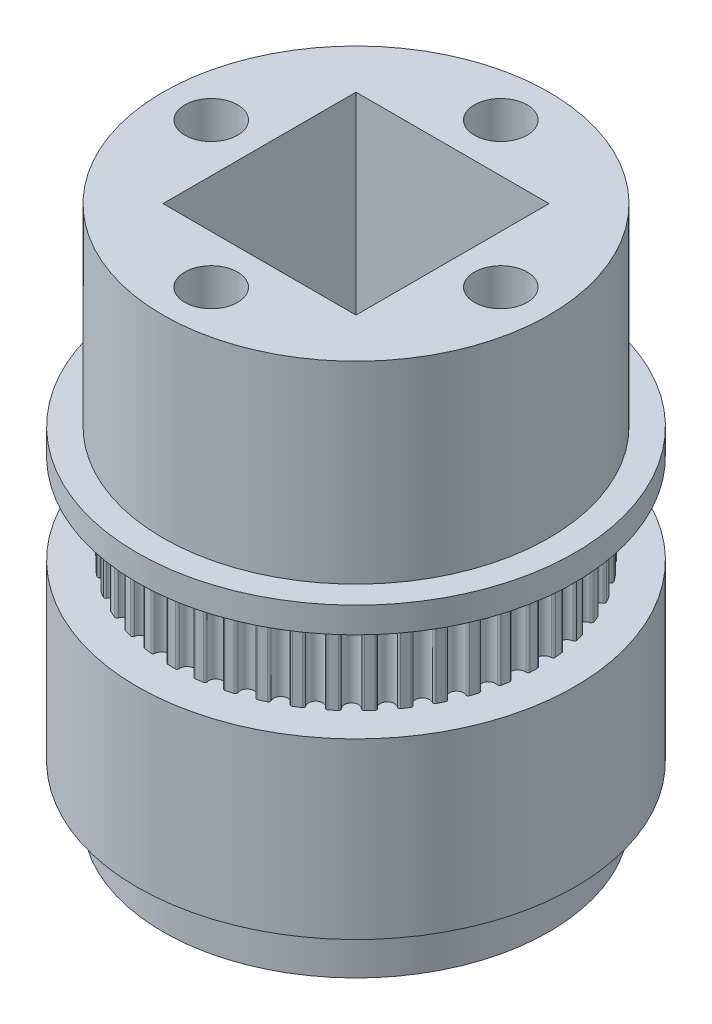
from build123d import *

# Parameters (mm, degrees)
CUT_EXTRUDE1_START       = -4
CUT_EXTRUDE1_DEPTH       = 13
CUT_EXTRUDE1_2_OUTLINE_R = 17
CUT_EXTRUDE1_2_DEPTH     = 4
CUT_EXTRUDE1_START_2     = 7
CUT_EXTRUDE1_3_OUTLINE_R = 17
CUT_EXTRUDE1_3_DEPTH     = 2
SKETCH2_R                = 17
CUT_EXTRUDE2_DEPTH       = 2
BOSS_EXTRUDE1_START      = 11.5
SKETCH3_R                = 17
BOSS_EXTRUDE1_DEPTH      = 11.5
SKETCH4_R                = 15
BOSS_EXTRUDE2_DEPTH      = 4
BOSS_EXTRUDE3_START      = 15
SKETCH5_R                = 15
BOSS_EXTRUDE3_DEPTH      = 15
SKETCH6_W                = 15
SKETCH6_H                = 15
CUT_EXTRUDE3_DEPTH       = 25
SKETCH7_R                = 2.05
CUT_EXTRUDE4_DEPTH       = 7


with BuildPart() as part:
    # Cut-Extrude1: read off the stored shape, not the designer's step
    # Cut-Extrude1 outline → Cut-Extrude1 (new body)
    with BuildSketch(Plane(origin=(0, 4, 0), x_dir=(1, 0, 0), z_dir=(0, 1, 0)).offset(CUT_EXTRUDE1_START)):
        with BuildLine():
            ThreePointArc((-2.696211539, 14.067901059), (-2.978115599, 14.010932316), (-3.258819048, 13.948315142))
            ThreePointArc((-3.258819048, 13.948315142), (-3.355231436, 13.876138224), (-3.367490736, 13.756327684))
            ThreePointArc((-3.367490736, 13.756327684), (-3.742864461, 13.052919583), (-4.433948937, 13.450525716))
            ThreePointArc((-4.433948937, 13.450525716), (-4.507835327, 13.545634377), (-4.627845608, 13.555753093))
            ThreePointArc((-4.627845608, 13.555753093), (-4.89907768, 13.460105303), (-5.168334716, 13.359031145))
            ThreePointArc((-5.168334716, 13.359031145), (-5.253763741, 13.274138638), (-5.249229329, 13.15378792))
            ThreePointArc((-5.249229329, 13.15378792), (-5.523054456, 12.404983413), (-6.262749424, 12.702539701))
            ThreePointArc((-6.262749424, 12.702539701), (-6.349153323, 12.786439774), (-6.469403926, 12.779757811))
            ThreePointArc((-6.469403926, 12.779757811), (-6.724684788, 12.647292651), (-6.977254629, 12.509728803))
            ThreePointArc((-6.977254629, 12.509728803), (-7.05003751, 12.413773041), (-7.028797645, 12.295224637))
            ThreePointArc((-7.028797645, 12.295224637), (-7.195744479, 11.515598352), (-7.969652618, 11.7073132))
            ThreePointArc((-7.969652618, 11.7073132), (-8.066892274, 11.778371664), (-8.185042656, 11.755019081))
            ThreePointArc((-8.185042656, 11.755019081), (-8.419403554, 11.588314833), (-8.650370216, 11.416938819))
            ThreePointArc((-8.650370216, 11.416938819), (-8.709090318, 11.311787473), (-8.671558409, 11.197348792))
            ThreePointArc((-8.671558409, 11.197348792), (-8.72837752, 10.402075267), (-9.521435588, 10.484217164))
            ThreePointArc((-9.521435588, 10.484217164), (-9.627618341, 10.541050948), (-9.741368841, 10.501482275))
            ThreePointArc((-9.741368841, 10.501482275), (-9.950248208, 10.303783649), (-10.155116186, 10.101931108))
            ThreePointArc((-10.155116186, 10.101931108), (-10.19863059, 9.989630829), (-10.145537152, 9.881529289))
            ThreePointArc((-10.145537152, 9.881529289), (-10.091122622, 9.08608762), (-10.887894645, 9.057057767))
            ThreePointArc((-10.887894645, 9.057057767), (-11.000953769, 9.098560665), (-11.108090362, 9.043546063))
            ThreePointArc((-11.108090362, 9.043546063), (-11.287422598, 8.818701036), (-11.462204372, 8.590300799))
            ThreePointArc((-11.462204372, 8.590300799), (-11.489666118, 8.473037384), (-11.422044556, 8.373377059))
            ThreePointArc((-11.422044556, 8.373377059), (-11.2574555, 7.593249613), (-12.042433218, 7.453613043))
            ThreePointArc((-12.042433218, 7.453613043), (-12.160168145, 7.478977249), (-12.258605539, 7.409587513))
            ThreePointArc((-12.258605539, 7.409587513), (-12.404900147, 7.161972439), (-12.546193787, 6.911470056))
            ThreePointArc((-12.546193787, 6.911470056), (-12.557068364, 6.791525904), (-12.476234854, 6.702246569))
            ThreePointArc((-12.476234854, 6.702246569), (-12.204674812, 5.952617639), (-12.962579526, 5.705092219))
            ThreePointArc((-12.962579526, 5.705092219), (-13.08269868, 5.713824047), (-13.170520904, 5.63140977))
            ThreePointArc((-13.170520904, 5.63140977), (-13.280930425, 5.365844195), (-13.385985812, 5.09811541))
            ThreePointArc((-13.385985812, 5.09811541), (-13.380061559, 4.977825097), (-13.287589432, 4.900664473))
            ThreePointArc((-13.287589432, 4.900664473), (-12.914344011, 4.196124733), (-13.630423969, 3.845528264))
            ThreePointArc((-13.630423969, 3.845528264), (-13.750589367, 3.83745776), (-13.82608706, 3.743623042))
            ThreePointArc((-13.82608706, 3.743623042), (-13.898462499, 3.465275898), (-13.965234848, 3.185531746))
            ThreePointArc((-13.965234848, 3.185531746), (-13.942627074, 3.067236587), (-13.840316197, 3.003696518))
            ThreePointArc((-13.840316197, 3.003696518), (-13.372650194, 2.357959033), (-14.032967713, 1.911115477))
            ThreePointArc((-14.032967713, 1.911115477), (-14.150840473, 1.886399723), (-14.212544159, 1.782970949))
            ThreePointArc((-14.212544159, 1.782970949), (-14.245476809, 1.497259946), (-14.272666474, 1.210945331))
            ThreePointArc((-14.272666474, 1.210945331), (-14.233815213, 1.096947806), (-14.12365695, 1.048265026))
            ThreePointArc((-14.12365695, 1.048265026), (-13.570672952, 0.473898342), (-14.162375703, -0.060495))
            ThreePointArc((-14.162375703, -0.060495), (-14.275661565, -0.101374939), (-14.322370252, -0.212384644))
            ThreePointArc((-14.322370252, -0.212384644), (-14.315219118, -0.499898467), (-14.302296882, -0.787210758))
            ThreePointArc((-14.302296882, -0.787210758), (-14.24795833, -0.894691816), (-14.132096786, -0.927569751))
            ThreePointArc((-14.132096786, -0.927569751), (-13.504557997, -1.419386241), (-14.01612916, -2.030928011))
            ThreePointArc((-14.01612916, -2.030928011), (-14.122623144, -2.087176454), (-14.1534277, -2.203606413))
            ThreePointArc((-14.1534277, -2.203606413), (-14.10633197, -2.487326925), (-14.053549349, -2.770044685))
            ThreePointArc((-14.053549349, -2.770044685), (-13.984781144, -2.86891728), (-13.865471432, -2.885350439))
            ThreePointArc((-13.865471432, -2.885350439), (-13.175592183, -3.285044085), (-13.597074605, -3.961831317))
            ThreePointArc((-13.597074605, -3.961831317), (-13.694703927, -4.032353453), (-13.709004777, -4.151937489))
            ThreePointArc((-13.709004777, -4.151937489), (-13.622881116, -4.426342394), (-13.531265465, -4.698962843))
            ThreePointArc((-13.531265465, -4.698962843), (-13.449406101, -4.787302532), (-13.32897045, -4.786971063))
            ThreePointArc((-13.32897045, -4.786971063), (-12.590178453, -5.086762283), (-12.91336846, -5.815622084))
            ThreePointArc((-12.91336846, -5.815622084), (-13.000232875, -5.899045278), (-12.997751669, -6.019455824))
            ThreePointArc((-12.997751669, -6.019455824), (-12.874276376, -6.279204142), (-12.745610889, -6.536421034))
            ThreePointArc((-12.745610889, -6.536421034), (-12.652253667, -6.612508386), (-12.533036219, -6.595418739))
            ThreePointArc((-12.533036219, -6.595418739), (-11.759711221, -6.789472439), (-11.978318286, -7.556218382))
            ThreePointArc((-11.978318286, -7.556218382), (-12.052727079, -7.650918897), (-12.03351211, -7.769812299))
            ThreePointArc((-12.03351211, -7.769812299), (-11.875088491, -8.009848325), (-11.711877496, -8.246655225))
            ThreePointArc((-11.711877496, -8.246655225), (-11.608839507, -8.309009286), (-11.493160693, -8.275494093))
            ThreePointArc((-11.493160693, -8.275494093), (-10.700354587, -8.360033237), (-10.810123772, -9.149741484))
            ThreePointArc((-10.810123772, -9.149741484), (-10.870628659, -9.253876083), (-10.835053926, -9.368938216))
            ThreePointArc((-10.835053926, -9.368938216), (-10.644765517, -9.584589922), (-10.450185729, -9.796377653))
            ThreePointArc((-10.450185729, -9.796377653), (-10.339472491, -9.843784772), (-10.229583869, -9.794496366))
            ThreePointArc((-10.229583869, -9.794496366), (-9.432727722, -9.767875498), (-9.431522495, -10.565175276))
            ThreePointArc((-9.431522495, -10.565175276), (-9.476945818, -10.676717097), (-9.425703742, -10.785708407))
            ThreePointArc((-9.425703742, -10.785708407), (-9.20725429, -10.972778378), (-8.985092983, -11.155424732))
            ThreePointArc((-8.985092983, -11.155424732), (-8.868859403, -11.186962184), (-8.76689983, -11.12285991))
            ThreePointArc((-8.76689983, -11.12285991), (-7.981503541, -10.985597172), (-7.869347361, -11.774969949))
            ThreePointArc((-7.869347361, -11.774969949), (-7.898805006, -11.891747957), (-7.832892956, -11.992547053))
            ThreePointArc((-7.832892956, -11.992547053), (-7.590534331, -12.147394183), (-7.345115624, -12.297344158))
            ThreePointArc((-7.345115624, -12.297344158), (-7.225624056, -12.312398102), (-7.133578059, -12.234729637))
            ThreePointArc((-7.133578059, -12.234729637), (-6.374928473, -11.989496694), (-6.154004332, -12.755578226))
            ThreePointArc((-6.154004332, -12.755578226), (-6.16692294, -12.875319471), (-6.087623818, -12.965964412))
            ThreePointArc((-6.087623818, -12.965964412), (-5.826073255, -13.085574779), (-5.562173943, -13.199909769))
            ThreePointArc((-5.562173943, -13.199909769), (-5.441750155, -13.198187196), (-5.361409304, -13.108464268))
            ThreePointArc((-5.361409304, -13.108464268), (-4.644272673, -12.7600343), (-4.318880609, -13.487913682))
            ThreePointArc((-4.318880609, -13.487913682), (-4.315008733, -13.608287535), (-4.223866008, -13.687014022))
            ThreePointArc((-4.223866008, -13.687014022), (-3.948214291, -13.769059546), (-3.670970874, -13.84555415))
            ThreePointArc((-3.670970874, -13.84555415), (-3.551958777, -13.827088589), (-3.484886816, -13.727057554))
            ThreePointArc((-3.484886816, -13.727057554), (-2.823221389, -13.282212353), (-2.399694787, -13.95772224))
            ThreePointArc((-2.399694787, -13.95772224), (-2.37910779, -14.076385763), (-2.27789545, -14.141661472))
            ThreePointArc((-2.27789545, -14.141661472), (-1.993507827, -14.184545231), (-1.708316532, -14.221710569))
            ThreePointArc((-1.708316532, -14.221710569), (-1.593032562, -14.186861431), (-1.540534971, -14.078469278))
            ThreePointArc((-1.540534971, -14.078469278), (-0.947219312, -13.545867251), (-0.433801636, -14.155859612))
            ThreePointArc((-0.433801636, -14.155859612), (-0.396900219, -14.270503153), (-0.287588248, -14.321057568))
            ThreePointArc((-0.287588248, -14.321057568), (0, -14.323944878), (0.287588248, -14.321057568))
            ThreePointArc((0.287588248, -14.321057568), (0.396900219, -14.270503153), (0.433801636, -14.155859612))
            ThreePointArc((0.433801636, -14.155859612), (0.947219312, -13.545867251), (1.540534971, -14.078469278))
            ThreePointArc((1.540534971, -14.078469278), (1.593032562, -14.186861431), (1.708316532, -14.221710569))
            ThreePointArc((1.708316532, -14.221710569), (1.993507827, -14.184545231), (2.27789545, -14.141661472))
            ThreePointArc((2.27789545, -14.141661472), (2.37910779, -14.076385763), (2.399694787, -13.95772224))
            ThreePointArc((2.399694787, -13.95772224), (2.823221389, -13.282212353), (3.484886816, -13.727057554))
            ThreePointArc((3.484886816, -13.727057554), (3.551958777, -13.827088589), (3.670970874, -13.84555415))
            ThreePointArc((3.670970874, -13.84555415), (3.948214291, -13.769059546), (4.223866008, -13.687014022))
            ThreePointArc((4.223866008, -13.687014022), (4.315008733, -13.608287535), (4.318880609, -13.487913682))
            ThreePointArc((4.318880609, -13.487913682), (4.644272673, -12.7600343), (5.361409304, -13.108464268))
            ThreePointArc((5.361409304, -13.108464268), (5.441750155, -13.198187196), (5.562173943, -13.199909769))
            ThreePointArc((5.562173943, -13.199909769), (5.826073255, -13.085574779), (6.087623818, -12.965964412))
            ThreePointArc((6.087623818, -12.965964412), (6.16692294, -12.875319471), (6.154004332, -12.755578226))
            ThreePointArc((6.154004332, -12.755578226), (6.374928473, -11.989496694), (7.133578059, -12.234729637))
            ThreePointArc((7.133578059, -12.234729637), (7.225624056, -12.312398102), (7.345115624, -12.297344158))
            ThreePointArc((7.345115624, -12.297344158), (7.590534331, -12.147394183), (7.832892956, -11.992547053))
            ThreePointArc((7.832892956, -11.992547053), (7.898805006, -11.891747957), (7.869347361, -11.774969949))
            ThreePointArc((7.869347361, -11.774969949), (7.981503541, -10.985597172), (8.76689983, -11.12285991))
            ThreePointArc((8.76689983, -11.12285991), (8.868859403, -11.186962184), (8.985092983, -11.155424732))
            ThreePointArc((8.985092983, -11.155424732), (9.20725429, -10.972778378), (9.425703742, -10.785708407))
            ThreePointArc((9.425703742, -10.785708407), (9.476945818, -10.676717097), (9.431522495, -10.565175276))
            ThreePointArc((9.431522495, -10.565175276), (9.432727722, -9.767875498), (10.229583869, -9.794496366))
            ThreePointArc((10.229583869, -9.794496366), (10.339472491, -9.843784772), (10.450185729, -9.796377653))
            ThreePointArc((10.450185729, -9.796377653), (10.644765517, -9.584589922), (10.835053926, -9.368938216))
            ThreePointArc((10.835053926, -9.368938216), (10.870628659, -9.253876083), (10.810123772, -9.149741484))
            ThreePointArc((10.810123772, -9.149741484), (10.700354587, -8.360033237), (11.493160693, -8.275494093))
            ThreePointArc((11.493160693, -8.275494093), (11.608839507, -8.309009286), (11.711877496, -8.246655225))
            ThreePointArc((11.711877496, -8.246655225), (11.875088491, -8.009848325), (12.03351211, -7.769812299))
            ThreePointArc((12.03351211, -7.769812299), (12.052727079, -7.650918897), (11.978318286, -7.556218382))
            ThreePointArc((11.978318286, -7.556218382), (11.759711221, -6.789472439), (12.533036219, -6.595418739))
            ThreePointArc((12.533036219, -6.595418739), (12.652253667, -6.612508386), (12.745610889, -6.536421034))
            ThreePointArc((12.745610889, -6.536421034), (12.874276376, -6.279204142), (12.997751669, -6.019455824))
            ThreePointArc((12.997751669, -6.019455824), (13.000232875, -5.899045278), (12.91336846, -5.815622084))
            ThreePointArc((12.91336846, -5.815622084), (12.590178453, -5.086762283), (13.32897045, -4.786971063))
            ThreePointArc((13.32897045, -4.786971063), (13.449406101, -4.787302532), (13.531265465, -4.698962843))
            ThreePointArc((13.531265465, -4.698962843), (13.622881116, -4.426342394), (13.709004777, -4.151937489))
            ThreePointArc((13.709004777, -4.151937489), (13.694703927, -4.032353453), (13.597074605, -3.961831317))
            ThreePointArc((13.597074605, -3.961831317), (13.175592183, -3.285044085), (13.865471432, -2.885350439))
            ThreePointArc((13.865471432, -2.885350439), (13.984781144, -2.86891728), (14.053549349, -2.770044685))
            ThreePointArc((14.053549349, -2.770044685), (14.10633197, -2.487326925), (14.1534277, -2.203606413))
            ThreePointArc((14.1534277, -2.203606413), (14.122623144, -2.087176454), (14.01612916, -2.030928011))
            ThreePointArc((14.01612916, -2.030928011), (13.504557997, -1.419386241), (14.132096786, -0.927569751))
            ThreePointArc((14.132096786, -0.927569751), (14.24795833, -0.894691816), (14.302296882, -0.787210758))
            ThreePointArc((14.302296882, -0.787210758), (14.315219118, -0.499898467), (14.322370252, -0.212384644))
            ThreePointArc((14.322370252, -0.212384644), (14.275661565, -0.101374939), (14.162375703, -0.060495))
            ThreePointArc((14.162375703, -0.060495), (13.570672952, 0.473898342), (14.12365695, 1.048265026))
            ThreePointArc((14.12365695, 1.048265026), (14.233815213, 1.096947806), (14.272666474, 1.210945331))
            ThreePointArc((14.272666474, 1.210945331), (14.245476809, 1.497259946), (14.212544159, 1.782970949))
            ThreePointArc((14.212544159, 1.782970949), (14.150840473, 1.886399723), (14.032967713, 1.911115477))
            ThreePointArc((14.032967713, 1.911115477), (13.372650194, 2.357959033), (13.840316197, 3.003696518))
            ThreePointArc((13.840316197, 3.003696518), (13.942627074, 3.067236587), (13.965234848, 3.185531746))
            ThreePointArc((13.965234848, 3.185531746), (13.898462499, 3.465275898), (13.82608706, 3.743623042))
            ThreePointArc((13.82608706, 3.743623042), (13.750589367, 3.83745776), (13.630423969, 3.845528264))
            ThreePointArc((13.630423969, 3.845528264), (12.914344011, 4.196124733), (13.287589432, 4.900664473))
            ThreePointArc((13.287589432, 4.900664473), (13.380061559, 4.977825097), (13.385985812, 5.09811541))
            ThreePointArc((13.385985812, 5.09811541), (13.280930425, 5.365844195), (13.170520904, 5.63140977))
            ThreePointArc((13.170520904, 5.63140977), (13.08269868, 5.713824047), (12.962579526, 5.705092219))
            ThreePointArc((12.962579526, 5.705092219), (12.204674812, 5.952617639), (12.476234854, 6.702246569))
            ThreePointArc((12.476234854, 6.702246569), (12.557068364, 6.791525904), (12.546193787, 6.911470056))
            ThreePointArc((12.546193787, 6.911470056), (12.404900147, 7.161972439), (12.258605539, 7.409587513))
            ThreePointArc((12.258605539, 7.409587513), (12.160168145, 7.478977249), (12.042433218, 7.453613043))
            ThreePointArc((12.042433218, 7.453613043), (11.2574555, 7.593249613), (11.422044556, 8.373377059))
            ThreePointArc((11.422044556, 8.373377059), (11.489666118, 8.473037384), (11.462204372, 8.590300799))
            ThreePointArc((11.462204372, 8.590300799), (11.287422598, 8.818701036), (11.108090362, 9.043546063))
            ThreePointArc((11.108090362, 9.043546063), (11.000953769, 9.098560665), (10.887894645, 9.057057767))
            ThreePointArc((10.887894645, 9.057057767), (10.091122622, 9.08608762), (10.145537152, 9.881529289))
            ThreePointArc((10.145537152, 9.881529289), (10.19863059, 9.989630829), (10.155116186, 10.101931108))
            ThreePointArc((10.155116186, 10.101931108), (9.950248208, 10.303783649), (9.741368841, 10.501482275))
            ThreePointArc((9.741368841, 10.501482275), (9.627618341, 10.541050948), (9.521435588, 10.484217164))
            ThreePointArc((9.521435588, 10.484217164), (8.72837752, 10.402075267), (8.671558409, 11.197348792))
            ThreePointArc((8.671558409, 11.197348792), (8.709090318, 11.311787473), (8.650370216, 11.416938819))
            ThreePointArc((8.650370216, 11.416938819), (8.419403554, 11.588314833), (8.185042656, 11.755019081))
            ThreePointArc((8.185042656, 11.755019081), (8.066892274, 11.778371664), (7.969652618, 11.7073132))
            ThreePointArc((7.969652618, 11.7073132), (7.195744479, 11.515598352), (7.028797645, 12.295224637))
            ThreePointArc((7.028797645, 12.295224637), (7.05003751, 12.413773041), (6.977254629, 12.509728803))
            ThreePointArc((6.977254629, 12.509728803), (6.724684788, 12.647292651), (6.469403926, 12.779757811))
            ThreePointArc((6.469403926, 12.779757811), (6.349153323, 12.786439774), (6.262749424, 12.702539701))
            ThreePointArc((6.262749424, 12.702539701), (5.523054456, 12.404983413), (5.249229329, 13.15378792))
            ThreePointArc((5.249229329, 13.15378792), (5.253763741, 13.274138638), (5.168334716, 13.359031145))
            ThreePointArc((5.168334716, 13.359031145), (4.89907768, 13.460105303), (4.627845608, 13.555753093))
            ThreePointArc((4.627845608, 13.555753093), (4.507835327, 13.545634377), (4.433948937, 13.450525716))
            ThreePointArc((4.433948937, 13.450525716), (3.742864461, 13.052919583), (3.367490736, 13.756327684))
            ThreePointArc((3.367490736, 13.756327684), (3.355231436, 13.876138224), (3.258819048, 13.948315142))
            ThreePointArc((3.258819048, 13.948315142), (2.978115599, 14.010932316), (2.696211539, 14.067901059))
            ThreePointArc((2.696211539, 14.067901059), (2.578777442, 14.041178616), (2.518846677, 13.936712547))
            ThreePointArc((2.518846677, 13.936712547), (1.889823866, 13.44679552), (1.420207766, 14.091116177))
            ThreePointArc((1.420207766, 14.091116177), (1.391393369, 14.208054564), (1.285874174, 14.26611105))
            ThreePointArc((1.285874174, 14.26611105), (0.999187885, 14.289052468), (0.712098779, 14.306233334))
            ThreePointArc((0.712098779, 14.306233334), (0.599526588, 14.263427284), (0.554717932, 14.151637121))
            ThreePointArc((0.554717932, 14.151637121), (0, 13.578944878), (-0.554717932, 14.151637121))
            ThreePointArc((-0.554717932, 14.151637121), (-0.599526588, 14.263427284), (-0.712098779, 14.306233334))
            ThreePointArc((-0.712098779, 14.306233334), (-0.999187885, 14.289052468), (-1.285874174, 14.26611105))
            ThreePointArc((-1.285874174, 14.26611105), (-1.391393369, 14.208054564), (-1.420207766, 14.091116177))
            ThreePointArc((-1.420207766, 14.091116177), (-1.889823866, 13.44679552), (-2.518846677, 13.936712547))
            ThreePointArc((-2.518846677, 13.936712547), (-2.578777442, 14.041178616), (-2.696211539, 14.067901059))
        make_face()
    extrude(amount=CUT_EXTRUDE1_DEPTH)

    # Cut-Extrude1 2 outline → Cut-Extrude1 2 (add)
    with BuildSketch(Plane(origin=(0, 4, 0), x_dir=(1, 0, 0), z_dir=(0, 1, 0)).offset(CUT_EXTRUDE1_START)):
        Circle(CUT_EXTRUDE1_2_OUTLINE_R)
        with BuildLine():
            ThreePointArc((-3.367490736, 13.756327684), (-3.355231436, 13.876138224), (-3.258819048, 13.948315142))
            ThreePointArc((-3.258819048, 13.948315142), (-2.978115599, 14.010932316), (-2.696211539, 14.067901059))
            ThreePointArc((-2.696211539, 14.067901059), (-2.578777442, 14.041178616), (-2.518846677, 13.936712547))
            ThreePointArc((-2.518846677, 13.936712547), (-1.889823866, 13.44679552), (-1.420207766, 14.091116177))
            ThreePointArc((-1.420207766, 14.091116177), (-1.391393369, 14.208054564), (-1.285874174, 14.26611105))
            ThreePointArc((-1.285874174, 14.26611105), (-0.999187885, 14.289052468), (-0.712098779, 14.306233334))
            ThreePointArc((-0.712098779, 14.306233334), (-0.599526588, 14.263427284), (-0.554717932, 14.151637121))
            ThreePointArc((-0.554717932, 14.151637121), (0, 13.578944878), (0.554717932, 14.151637121))
            ThreePointArc((0.554717932, 14.151637121), (0.599526588, 14.263427284), (0.712098779, 14.306233334))
            ThreePointArc((0.712098779, 14.306233334), (0.999187885, 14.289052468), (1.285874174, 14.26611105))
            ThreePointArc((1.285874174, 14.26611105), (1.391393369, 14.208054564), (1.420207766, 14.091116177))
            ThreePointArc((1.420207766, 14.091116177), (1.889823866, 13.44679552), (2.518846677, 13.936712547))
            ThreePointArc((2.518846677, 13.936712547), (2.578777442, 14.041178616), (2.696211539, 14.067901059))
            ThreePointArc((2.696211539, 14.067901059), (2.978115599, 14.010932316), (3.258819048, 13.948315142))
            ThreePointArc((3.258819048, 13.948315142), (3.355231436, 13.876138224), (3.367490736, 13.756327684))
            ThreePointArc((3.367490736, 13.756327684), (3.742864461, 13.052919583), (4.433948937, 13.450525716))
            ThreePointArc((4.433948937, 13.450525716), (4.507835327, 13.545634377), (4.627845608, 13.555753093))
            ThreePointArc((4.627845608, 13.555753093), (4.89907768, 13.460105303), (5.168334716, 13.359031145))
            ThreePointArc((5.168334716, 13.359031145), (5.253763741, 13.274138638), (5.249229329, 13.15378792))
            ThreePointArc((5.249229329, 13.15378792), (5.523054456, 12.404983413), (6.262749424, 12.702539701))
            ThreePointArc((6.262749424, 12.702539701), (6.349153323, 12.786439774), (6.469403926, 12.779757811))
            ThreePointArc((6.469403926, 12.779757811), (6.724684788, 12.647292651), (6.977254629, 12.509728803))
            ThreePointArc((6.977254629, 12.509728803), (7.05003751, 12.413773041), (7.028797645, 12.295224637))
            ThreePointArc((7.028797645, 12.295224637), (7.195744479, 11.515598352), (7.969652618, 11.7073132))
            ThreePointArc((7.969652618, 11.7073132), (8.066892274, 11.778371664), (8.185042656, 11.755019081))
            ThreePointArc((8.185042656, 11.755019081), (8.419403554, 11.588314833), (8.650370216, 11.416938819))
            ThreePointArc((8.650370216, 11.416938819), (8.709090318, 11.311787473), (8.671558409, 11.197348792))
            ThreePointArc((8.671558409, 11.197348792), (8.72837752, 10.402075267), (9.521435588, 10.484217164))
            ThreePointArc((9.521435588, 10.484217164), (9.627618341, 10.541050948), (9.741368841, 10.501482275))
            ThreePointArc((9.741368841, 10.501482275), (9.950248208, 10.303783649), (10.155116186, 10.101931108))
            ThreePointArc((10.155116186, 10.101931108), (10.19863059, 9.989630829), (10.145537152, 9.881529289))
            ThreePointArc((10.145537152, 9.881529289), (10.091122622, 9.08608762), (10.887894645, 9.057057767))
            ThreePointArc((10.887894645, 9.057057767), (11.000953769, 9.098560665), (11.108090362, 9.043546063))
            ThreePointArc((11.108090362, 9.043546063), (11.287422598, 8.818701036), (11.462204372, 8.590300799))
            ThreePointArc((11.462204372, 8.590300799), (11.489666118, 8.473037384), (11.422044556, 8.373377059))
            ThreePointArc((11.422044556, 8.373377059), (11.2574555, 7.593249613), (12.042433218, 7.453613043))
            ThreePointArc((12.042433218, 7.453613043), (12.160168145, 7.478977249), (12.258605539, 7.409587513))
            ThreePointArc((12.258605539, 7.409587513), (12.404900147, 7.161972439), (12.546193787, 6.911470056))
            ThreePointArc((12.546193787, 6.911470056), (12.557068364, 6.791525904), (12.476234854, 6.702246569))
            ThreePointArc((12.476234854, 6.702246569), (12.204674812, 5.952617639), (12.962579526, 5.705092219))
            ThreePointArc((12.962579526, 5.705092219), (13.08269868, 5.713824047), (13.170520904, 5.63140977))
            ThreePointArc((13.170520904, 5.63140977), (13.280930425, 5.365844195), (13.385985812, 5.09811541))
            ThreePointArc((13.385985812, 5.09811541), (13.380061559, 4.977825097), (13.287589432, 4.900664473))
            ThreePointArc((13.287589432, 4.900664473), (12.914344011, 4.196124733), (13.630423969, 3.845528264))
            ThreePointArc((13.630423969, 3.845528264), (13.750589367, 3.83745776), (13.82608706, 3.743623042))
            ThreePointArc((13.82608706, 3.743623042), (13.898462499, 3.465275898), (13.965234848, 3.185531746))
            ThreePointArc((13.965234848, 3.185531746), (13.942627074, 3.067236587), (13.840316197, 3.003696518))
            ThreePointArc((13.840316197, 3.003696518), (13.372650194, 2.357959033), (14.032967713, 1.911115477))
            ThreePointArc((14.032967713, 1.911115477), (14.150840473, 1.886399723), (14.212544159, 1.782970949))
            ThreePointArc((14.212544159, 1.782970949), (14.245476809, 1.497259946), (14.272666474, 1.210945331))
            ThreePointArc((14.272666474, 1.210945331), (14.233815213, 1.096947806), (14.12365695, 1.048265026))
            ThreePointArc((14.12365695, 1.048265026), (13.570672952, 0.473898342), (14.162375703, -0.060495))
            ThreePointArc((14.162375703, -0.060495), (14.275661565, -0.101374939), (14.322370252, -0.212384644))
            ThreePointArc((14.322370252, -0.212384644), (14.315219118, -0.499898467), (14.302296882, -0.787210758))
            ThreePointArc((14.302296882, -0.787210758), (14.24795833, -0.894691816), (14.132096786, -0.927569751))
            ThreePointArc((14.132096786, -0.927569751), (13.504557997, -1.419386241), (14.01612916, -2.030928011))
            ThreePointArc((14.01612916, -2.030928011), (14.122623144, -2.087176454), (14.1534277, -2.203606413))
            ThreePointArc((14.1534277, -2.203606413), (14.10633197, -2.487326925), (14.053549349, -2.770044685))
            ThreePointArc((14.053549349, -2.770044685), (13.984781144, -2.86891728), (13.865471432, -2.885350439))
            ThreePointArc((13.865471432, -2.885350439), (13.175592183, -3.285044085), (13.597074605, -3.961831317))
            ThreePointArc((13.597074605, -3.961831317), (13.694703927, -4.032353453), (13.709004777, -4.151937489))
            ThreePointArc((13.709004777, -4.151937489), (13.622881116, -4.426342394), (13.531265465, -4.698962843))
            ThreePointArc((13.531265465, -4.698962843), (13.449406101, -4.787302532), (13.32897045, -4.786971063))
            ThreePointArc((13.32897045, -4.786971063), (12.590178453, -5.086762283), (12.91336846, -5.815622084))
            ThreePointArc((12.91336846, -5.815622084), (13.000232875, -5.899045278), (12.997751669, -6.019455824))
            ThreePointArc((12.997751669, -6.019455824), (12.874276376, -6.279204142), (12.745610889, -6.536421034))
            ThreePointArc((12.745610889, -6.536421034), (12.652253667, -6.612508386), (12.533036219, -6.595418739))
            ThreePointArc((12.533036219, -6.595418739), (11.759711221, -6.789472439), (11.978318286, -7.556218382))
            ThreePointArc((11.978318286, -7.556218382), (12.052727079, -7.650918897), (12.03351211, -7.769812299))
            ThreePointArc((12.03351211, -7.769812299), (11.875088491, -8.009848325), (11.711877496, -8.246655225))
            ThreePointArc((11.711877496, -8.246655225), (11.608839507, -8.309009286), (11.493160693, -8.275494093))
            ThreePointArc((11.493160693, -8.275494093), (10.700354587, -8.360033237), (10.810123772, -9.149741484))
            ThreePointArc((10.810123772, -9.149741484), (10.870628659, -9.253876083), (10.835053926, -9.368938216))
            ThreePointArc((10.835053926, -9.368938216), (10.644765517, -9.584589922), (10.450185729, -9.796377653))
            ThreePointArc((10.450185729, -9.796377653), (10.339472491, -9.843784772), (10.229583869, -9.794496366))
            ThreePointArc((10.229583869, -9.794496366), (9.432727722, -9.767875498), (9.431522495, -10.565175276))
            ThreePointArc((9.431522495, -10.565175276), (9.476945818, -10.676717097), (9.425703742, -10.785708407))
            ThreePointArc((9.425703742, -10.785708407), (9.20725429, -10.972778378), (8.985092983, -11.155424732))
            ThreePointArc((8.985092983, -11.155424732), (8.868859403, -11.186962184), (8.76689983, -11.12285991))
            ThreePointArc((8.76689983, -11.12285991), (7.981503541, -10.985597172), (7.869347361, -11.774969949))
            ThreePointArc((7.869347361, -11.774969949), (7.898805006, -11.891747957), (7.832892956, -11.992547053))
            ThreePointArc((7.832892956, -11.992547053), (7.590534331, -12.147394183), (7.345115624, -12.297344158))
            ThreePointArc((7.345115624, -12.297344158), (7.225624056, -12.312398102), (7.133578059, -12.234729637))
            ThreePointArc((7.133578059, -12.234729637), (6.374928473, -11.989496694), (6.154004332, -12.755578226))
            ThreePointArc((6.154004332, -12.755578226), (6.16692294, -12.875319471), (6.087623818, -12.965964412))
            ThreePointArc((6.087623818, -12.965964412), (5.826073255, -13.085574779), (5.562173943, -13.199909769))
            ThreePointArc((5.562173943, -13.199909769), (5.441750155, -13.198187196), (5.361409304, -13.108464268))
            ThreePointArc((5.361409304, -13.108464268), (4.644272673, -12.7600343), (4.318880609, -13.487913682))
            ThreePointArc((4.318880609, -13.487913682), (4.315008733, -13.608287535), (4.223866008, -13.687014022))
            ThreePointArc((4.223866008, -13.687014022), (3.948214291, -13.769059546), (3.670970874, -13.84555415))
            ThreePointArc((3.670970874, -13.84555415), (3.551958777, -13.827088589), (3.484886816, -13.727057554))
            ThreePointArc((3.484886816, -13.727057554), (2.823221389, -13.282212353), (2.399694787, -13.95772224))
            ThreePointArc((2.399694787, -13.95772224), (2.37910779, -14.076385763), (2.27789545, -14.141661472))
            ThreePointArc((2.27789545, -14.141661472), (1.993507827, -14.184545231), (1.708316532, -14.221710569))
            ThreePointArc((1.708316532, -14.221710569), (1.593032562, -14.186861431), (1.540534971, -14.078469278))
            ThreePointArc((1.540534971, -14.078469278), (0.947219312, -13.545867251), (0.433801636, -14.155859612))
            ThreePointArc((0.433801636, -14.155859612), (0.396900219, -14.270503153), (0.287588248, -14.321057568))
            ThreePointArc((0.287588248, -14.321057568), (0, -14.323944878), (-0.287588248, -14.321057568))
            ThreePointArc((-0.287588248, -14.321057568), (-0.396900219, -14.270503153), (-0.433801636, -14.155859612))
            ThreePointArc((-0.433801636, -14.155859612), (-0.947219312, -13.545867251), (-1.540534971, -14.078469278))
            ThreePointArc((-1.540534971, -14.078469278), (-1.593032562, -14.186861431), (-1.708316532, -14.221710569))
            ThreePointArc((-1.708316532, -14.221710569), (-1.993507827, -14.184545231), (-2.27789545, -14.141661472))
            ThreePointArc((-2.27789545, -14.141661472), (-2.37910779, -14.076385763), (-2.399694787, -13.95772224))
            ThreePointArc((-2.399694787, -13.95772224), (-2.823221389, -13.282212353), (-3.484886816, -13.727057554))
            ThreePointArc((-3.484886816, -13.727057554), (-3.551958777, -13.827088589), (-3.670970874, -13.84555415))
            ThreePointArc((-3.670970874, -13.84555415), (-3.948214291, -13.769059546), (-4.223866008, -13.687014022))
            ThreePointArc((-4.223866008, -13.687014022), (-4.315008733, -13.608287535), (-4.318880609, -13.487913682))
            ThreePointArc((-4.318880609, -13.487913682), (-4.644272673, -12.7600343), (-5.361409304, -13.108464268))
            ThreePointArc((-5.361409304, -13.108464268), (-5.441750155, -13.198187196), (-5.562173943, -13.199909769))
            ThreePointArc((-5.562173943, -13.199909769), (-5.826073255, -13.085574779), (-6.087623818, -12.965964412))
            ThreePointArc((-6.087623818, -12.965964412), (-6.16692294, -12.875319471), (-6.154004332, -12.755578226))
            ThreePointArc((-6.154004332, -12.755578226), (-6.374928473, -11.989496694), (-7.133578059, -12.234729637))
            ThreePointArc((-7.133578059, -12.234729637), (-7.225624056, -12.312398102), (-7.345115624, -12.297344158))
            ThreePointArc((-7.345115624, -12.297344158), (-7.590534331, -12.147394183), (-7.832892956, -11.992547053))
            ThreePointArc((-7.832892956, -11.992547053), (-7.898805006, -11.891747957), (-7.869347361, -11.774969949))
            ThreePointArc((-7.869347361, -11.774969949), (-7.981503541, -10.985597172), (-8.76689983, -11.12285991))
            ThreePointArc((-8.76689983, -11.12285991), (-8.868859403, -11.186962184), (-8.985092983, -11.155424732))
            ThreePointArc((-8.985092983, -11.155424732), (-9.20725429, -10.972778378), (-9.425703742, -10.785708407))
            ThreePointArc((-9.425703742, -10.785708407), (-9.476945818, -10.676717097), (-9.431522495, -10.565175276))
            ThreePointArc((-9.431522495, -10.565175276), (-9.432727722, -9.767875498), (-10.229583869, -9.794496366))
            ThreePointArc((-10.229583869, -9.794496366), (-10.339472491, -9.843784772), (-10.450185729, -9.796377653))
            ThreePointArc((-10.450185729, -9.796377653), (-10.644765517, -9.584589922), (-10.835053926, -9.368938216))
            ThreePointArc((-10.835053926, -9.368938216), (-10.870628659, -9.253876083), (-10.810123772, -9.149741484))
            ThreePointArc((-10.810123772, -9.149741484), (-10.700354587, -8.360033237), (-11.493160693, -8.275494093))
            ThreePointArc((-11.493160693, -8.275494093), (-11.608839507, -8.309009286), (-11.711877496, -8.246655225))
            ThreePointArc((-11.711877496, -8.246655225), (-11.875088491, -8.009848325), (-12.03351211, -7.769812299))
            ThreePointArc((-12.03351211, -7.769812299), (-12.052727079, -7.650918897), (-11.978318286, -7.556218382))
            ThreePointArc((-11.978318286, -7.556218382), (-11.759711221, -6.789472439), (-12.533036219, -6.595418739))
            ThreePointArc((-12.533036219, -6.595418739), (-12.652253667, -6.612508386), (-12.745610889, -6.536421034))
            ThreePointArc((-12.745610889, -6.536421034), (-12.874276376, -6.279204142), (-12.997751669, -6.019455824))
            ThreePointArc((-12.997751669, -6.019455824), (-13.000232875, -5.899045278), (-12.91336846, -5.815622084))
            ThreePointArc((-12.91336846, -5.815622084), (-12.590178453, -5.086762283), (-13.32897045, -4.786971063))
            ThreePointArc((-13.32897045, -4.786971063), (-13.449406101, -4.787302532), (-13.531265465, -4.698962843))
            ThreePointArc((-13.531265465, -4.698962843), (-13.622881116, -4.426342394), (-13.709004777, -4.151937489))
            ThreePointArc((-13.709004777, -4.151937489), (-13.694703927, -4.032353453), (-13.597074605, -3.961831317))
            ThreePointArc((-13.597074605, -3.961831317), (-13.175592183, -3.285044085), (-13.865471432, -2.885350439))
            ThreePointArc((-13.865471432, -2.885350439), (-13.984781144, -2.86891728), (-14.053549349, -2.770044685))
            ThreePointArc((-14.053549349, -2.770044685), (-14.10633197, -2.487326925), (-14.1534277, -2.203606413))
            ThreePointArc((-14.1534277, -2.203606413), (-14.122623144, -2.087176454), (-14.01612916, -2.030928011))
            ThreePointArc((-14.01612916, -2.030928011), (-13.504557997, -1.419386241), (-14.132096786, -0.927569751))
            ThreePointArc((-14.132096786, -0.927569751), (-14.24795833, -0.894691816), (-14.302296882, -0.787210758))
            ThreePointArc((-14.302296882, -0.787210758), (-14.315219118, -0.499898467), (-14.322370252, -0.212384644))
            ThreePointArc((-14.322370252, -0.212384644), (-14.275661565, -0.101374939), (-14.162375703, -0.060495))
            ThreePointArc((-14.162375703, -0.060495), (-13.570672952, 0.473898342), (-14.12365695, 1.048265026))
            ThreePointArc((-14.12365695, 1.048265026), (-14.233815213, 1.096947806), (-14.272666474, 1.210945331))
            ThreePointArc((-14.272666474, 1.210945331), (-14.245476809, 1.497259946), (-14.212544159, 1.782970949))
            ThreePointArc((-14.212544159, 1.782970949), (-14.150840473, 1.886399723), (-14.032967713, 1.911115477))
            ThreePointArc((-14.032967713, 1.911115477), (-13.372650194, 2.357959033), (-13.840316197, 3.003696518))
            ThreePointArc((-13.840316197, 3.003696518), (-13.942627074, 3.067236587), (-13.965234848, 3.185531746))
            ThreePointArc((-13.965234848, 3.185531746), (-13.898462499, 3.465275898), (-13.82608706, 3.743623042))
            ThreePointArc((-13.82608706, 3.743623042), (-13.750589367, 3.83745776), (-13.630423969, 3.845528264))
            ThreePointArc((-13.630423969, 3.845528264), (-12.914344011, 4.196124733), (-13.287589432, 4.900664473))
            ThreePointArc((-13.287589432, 4.900664473), (-13.380061559, 4.977825097), (-13.385985812, 5.09811541))
            ThreePointArc((-13.385985812, 5.09811541), (-13.280930425, 5.365844195), (-13.170520904, 5.63140977))
            ThreePointArc((-13.170520904, 5.63140977), (-13.08269868, 5.713824047), (-12.962579526, 5.705092219))
            ThreePointArc((-12.962579526, 5.705092219), (-12.204674812, 5.952617639), (-12.476234854, 6.702246569))
            ThreePointArc((-12.476234854, 6.702246569), (-12.557068364, 6.791525904), (-12.546193787, 6.911470056))
            ThreePointArc((-12.546193787, 6.911470056), (-12.404900147, 7.161972439), (-12.258605539, 7.409587513))
            ThreePointArc((-12.258605539, 7.409587513), (-12.160168145, 7.478977249), (-12.042433218, 7.453613043))
            ThreePointArc((-12.042433218, 7.453613043), (-11.2574555, 7.593249613), (-11.422044556, 8.373377059))
            ThreePointArc((-11.422044556, 8.373377059), (-11.489666118, 8.473037384), (-11.462204372, 8.590300799))
            ThreePointArc((-11.462204372, 8.590300799), (-11.287422598, 8.818701036), (-11.108090362, 9.043546063))
            ThreePointArc((-11.108090362, 9.043546063), (-11.000953769, 9.098560665), (-10.887894645, 9.057057767))
            ThreePointArc((-10.887894645, 9.057057767), (-10.091122622, 9.08608762), (-10.145537152, 9.881529289))
            ThreePointArc((-10.145537152, 9.881529289), (-10.19863059, 9.989630829), (-10.155116186, 10.101931108))
            ThreePointArc((-10.155116186, 10.101931108), (-9.950248208, 10.303783649), (-9.741368841, 10.501482275))
            ThreePointArc((-9.741368841, 10.501482275), (-9.627618341, 10.541050948), (-9.521435588, 10.484217164))
            ThreePointArc((-9.521435588, 10.484217164), (-8.72837752, 10.402075267), (-8.671558409, 11.197348792))
            ThreePointArc((-8.671558409, 11.197348792), (-8.709090318, 11.311787473), (-8.650370216, 11.416938819))
            ThreePointArc((-8.650370216, 11.416938819), (-8.419403554, 11.588314833), (-8.185042656, 11.755019081))
            ThreePointArc((-8.185042656, 11.755019081), (-8.066892274, 11.778371664), (-7.969652618, 11.7073132))
            ThreePointArc((-7.969652618, 11.7073132), (-7.195744479, 11.515598352), (-7.028797645, 12.295224637))
            ThreePointArc((-7.028797645, 12.295224637), (-7.05003751, 12.413773041), (-6.977254629, 12.509728803))
            ThreePointArc((-6.977254629, 12.509728803), (-6.724684788, 12.647292651), (-6.469403926, 12.779757811))
            ThreePointArc((-6.469403926, 12.779757811), (-6.349153323, 12.786439774), (-6.262749424, 12.702539701))
            ThreePointArc((-6.262749424, 12.702539701), (-5.523054456, 12.404983413), (-5.249229329, 13.15378792))
            ThreePointArc((-5.249229329, 13.15378792), (-5.253763741, 13.274138638), (-5.168334716, 13.359031145))
            ThreePointArc((-5.168334716, 13.359031145), (-4.89907768, 13.460105303), (-4.627845608, 13.555753093))
            ThreePointArc((-4.627845608, 13.555753093), (-4.507835327, 13.545634377), (-4.433948937, 13.450525716))
            ThreePointArc((-4.433948937, 13.450525716), (-3.742864461, 13.052919583), (-3.367490736, 13.756327684))
        make_face(mode=Mode.SUBTRACT)
    extrude(amount=CUT_EXTRUDE1_2_DEPTH)

    # Cut-Extrude1 3 outline → Cut-Extrude1 3 (add)
    with BuildSketch(Plane(origin=(0, 4, 0), x_dir=(1, 0, 0), z_dir=(0, 1, 0)).offset(CUT_EXTRUDE1_START_2)):
        Circle(CUT_EXTRUDE1_3_OUTLINE_R)
        with BuildLine():
            ThreePointArc((-3.367490736, 13.756327684), (-3.355231436, 13.876138224), (-3.258819048, 13.948315142))
            ThreePointArc((-3.258819048, 13.948315142), (-2.978115599, 14.010932316), (-2.696211539, 14.067901059))
            ThreePointArc((-2.696211539, 14.067901059), (-2.578777442, 14.041178616), (-2.518846677, 13.936712547))
            ThreePointArc((-2.518846677, 13.936712547), (-1.889823866, 13.44679552), (-1.420207766, 14.091116177))
            ThreePointArc((-1.420207766, 14.091116177), (-1.391393369, 14.208054564), (-1.285874174, 14.26611105))
            ThreePointArc((-1.285874174, 14.26611105), (-0.999187885, 14.289052468), (-0.712098779, 14.306233334))
            ThreePointArc((-0.712098779, 14.306233334), (-0.599526588, 14.263427284), (-0.554717932, 14.151637121))
            ThreePointArc((-0.554717932, 14.151637121), (0, 13.578944878), (0.554717932, 14.151637121))
            ThreePointArc((0.554717932, 14.151637121), (0.599526588, 14.263427284), (0.712098779, 14.306233334))
            ThreePointArc((0.712098779, 14.306233334), (0.999187885, 14.289052468), (1.285874174, 14.26611105))
            ThreePointArc((1.285874174, 14.26611105), (1.391393369, 14.208054564), (1.420207766, 14.091116177))
            ThreePointArc((1.420207766, 14.091116177), (1.889823866, 13.44679552), (2.518846677, 13.936712547))
            ThreePointArc((2.518846677, 13.936712547), (2.578777442, 14.041178616), (2.696211539, 14.067901059))
            ThreePointArc((2.696211539, 14.067901059), (2.978115599, 14.010932316), (3.258819048, 13.948315142))
            ThreePointArc((3.258819048, 13.948315142), (3.355231436, 13.876138224), (3.367490736, 13.756327684))
            ThreePointArc((3.367490736, 13.756327684), (3.742864461, 13.052919583), (4.433948937, 13.450525716))
            ThreePointArc((4.433948937, 13.450525716), (4.507835327, 13.545634377), (4.627845608, 13.555753093))
            ThreePointArc((4.627845608, 13.555753093), (4.89907768, 13.460105303), (5.168334716, 13.359031145))
            ThreePointArc((5.168334716, 13.359031145), (5.253763741, 13.274138638), (5.249229329, 13.15378792))
            ThreePointArc((5.249229329, 13.15378792), (5.523054456, 12.404983413), (6.262749424, 12.702539701))
            ThreePointArc((6.262749424, 12.702539701), (6.349153323, 12.786439774), (6.469403926, 12.779757811))
            ThreePointArc((6.469403926, 12.779757811), (6.724684788, 12.647292651), (6.977254629, 12.509728803))
            ThreePointArc((6.977254629, 12.509728803), (7.05003751, 12.413773041), (7.028797645, 12.295224637))
            ThreePointArc((7.028797645, 12.295224637), (7.195744479, 11.515598352), (7.969652618, 11.7073132))
            ThreePointArc((7.969652618, 11.7073132), (8.066892274, 11.778371664), (8.185042656, 11.755019081))
            ThreePointArc((8.185042656, 11.755019081), (8.419403554, 11.588314833), (8.650370216, 11.416938819))
            ThreePointArc((8.650370216, 11.416938819), (8.709090318, 11.311787473), (8.671558409, 11.197348792))
            ThreePointArc((8.671558409, 11.197348792), (8.72837752, 10.402075267), (9.521435588, 10.484217164))
            ThreePointArc((9.521435588, 10.484217164), (9.627618341, 10.541050948), (9.741368841, 10.501482275))
            ThreePointArc((9.741368841, 10.501482275), (9.950248208, 10.303783649), (10.155116186, 10.101931108))
            ThreePointArc((10.155116186, 10.101931108), (10.19863059, 9.989630829), (10.145537152, 9.881529289))
            ThreePointArc((10.145537152, 9.881529289), (10.091122622, 9.08608762), (10.887894645, 9.057057767))
            ThreePointArc((10.887894645, 9.057057767), (11.000953769, 9.098560665), (11.108090362, 9.043546063))
            ThreePointArc((11.108090362, 9.043546063), (11.287422598, 8.818701036), (11.462204372, 8.590300799))
            ThreePointArc((11.462204372, 8.590300799), (11.489666118, 8.473037384), (11.422044556, 8.373377059))
            ThreePointArc((11.422044556, 8.373377059), (11.2574555, 7.593249613), (12.042433218, 7.453613043))
            ThreePointArc((12.042433218, 7.453613043), (12.160168145, 7.478977249), (12.258605539, 7.409587513))
            ThreePointArc((12.258605539, 7.409587513), (12.404900147, 7.161972439), (12.546193787, 6.911470056))
            ThreePointArc((12.546193787, 6.911470056), (12.557068364, 6.791525904), (12.476234854, 6.702246569))
            ThreePointArc((12.476234854, 6.702246569), (12.204674812, 5.952617639), (12.962579526, 5.705092219))
            ThreePointArc((12.962579526, 5.705092219), (13.08269868, 5.713824047), (13.170520904, 5.63140977))
            ThreePointArc((13.170520904, 5.63140977), (13.280930425, 5.365844195), (13.385985812, 5.09811541))
            ThreePointArc((13.385985812, 5.09811541), (13.380061559, 4.977825097), (13.287589432, 4.900664473))
            ThreePointArc((13.287589432, 4.900664473), (12.914344011, 4.196124733), (13.630423969, 3.845528264))
            ThreePointArc((13.630423969, 3.845528264), (13.750589367, 3.83745776), (13.82608706, 3.743623042))
            ThreePointArc((13.82608706, 3.743623042), (13.898462499, 3.465275898), (13.965234848, 3.185531746))
            ThreePointArc((13.965234848, 3.185531746), (13.942627074, 3.067236587), (13.840316197, 3.003696518))
            ThreePointArc((13.840316197, 3.003696518), (13.372650194, 2.357959033), (14.032967713, 1.911115477))
            ThreePointArc((14.032967713, 1.911115477), (14.150840473, 1.886399723), (14.212544159, 1.782970949))
            ThreePointArc((14.212544159, 1.782970949), (14.245476809, 1.497259946), (14.272666474, 1.210945331))
            ThreePointArc((14.272666474, 1.210945331), (14.233815213, 1.096947806), (14.12365695, 1.048265026))
            ThreePointArc((14.12365695, 1.048265026), (13.570672952, 0.473898342), (14.162375703, -0.060495))
            ThreePointArc((14.162375703, -0.060495), (14.275661565, -0.101374939), (14.322370252, -0.212384644))
            ThreePointArc((14.322370252, -0.212384644), (14.315219118, -0.499898467), (14.302296882, -0.787210758))
            ThreePointArc((14.302296882, -0.787210758), (14.24795833, -0.894691816), (14.132096786, -0.927569751))
            ThreePointArc((14.132096786, -0.927569751), (13.504557997, -1.419386241), (14.01612916, -2.030928011))
            ThreePointArc((14.01612916, -2.030928011), (14.122623144, -2.087176454), (14.1534277, -2.203606413))
            ThreePointArc((14.1534277, -2.203606413), (14.10633197, -2.487326925), (14.053549349, -2.770044685))
            ThreePointArc((14.053549349, -2.770044685), (13.984781144, -2.86891728), (13.865471432, -2.885350439))
            ThreePointArc((13.865471432, -2.885350439), (13.175592183, -3.285044085), (13.597074605, -3.961831317))
            ThreePointArc((13.597074605, -3.961831317), (13.694703927, -4.032353453), (13.709004777, -4.151937489))
            ThreePointArc((13.709004777, -4.151937489), (13.622881116, -4.426342394), (13.531265465, -4.698962843))
            ThreePointArc((13.531265465, -4.698962843), (13.449406101, -4.787302532), (13.32897045, -4.786971063))
            ThreePointArc((13.32897045, -4.786971063), (12.590178453, -5.086762283), (12.91336846, -5.815622084))
            ThreePointArc((12.91336846, -5.815622084), (13.000232875, -5.899045278), (12.997751669, -6.019455824))
            ThreePointArc((12.997751669, -6.019455824), (12.874276376, -6.279204142), (12.745610889, -6.536421034))
            ThreePointArc((12.745610889, -6.536421034), (12.652253667, -6.612508386), (12.533036219, -6.595418739))
            ThreePointArc((12.533036219, -6.595418739), (11.759711221, -6.789472439), (11.978318286, -7.556218382))
            ThreePointArc((11.978318286, -7.556218382), (12.052727079, -7.650918897), (12.03351211, -7.769812299))
            ThreePointArc((12.03351211, -7.769812299), (11.875088491, -8.009848325), (11.711877496, -8.246655225))
            ThreePointArc((11.711877496, -8.246655225), (11.608839507, -8.309009286), (11.493160693, -8.275494093))
            ThreePointArc((11.493160693, -8.275494093), (10.700354587, -8.360033237), (10.810123772, -9.149741484))
            ThreePointArc((10.810123772, -9.149741484), (10.870628659, -9.253876083), (10.835053926, -9.368938216))
            ThreePointArc((10.835053926, -9.368938216), (10.644765517, -9.584589922), (10.450185729, -9.796377653))
            ThreePointArc((10.450185729, -9.796377653), (10.339472491, -9.843784772), (10.229583869, -9.794496366))
            ThreePointArc((10.229583869, -9.794496366), (9.432727722, -9.767875498), (9.431522495, -10.565175276))
            ThreePointArc((9.431522495, -10.565175276), (9.476945818, -10.676717097), (9.425703742, -10.785708407))
            ThreePointArc((9.425703742, -10.785708407), (9.20725429, -10.972778378), (8.985092983, -11.155424732))
            ThreePointArc((8.985092983, -11.155424732), (8.868859403, -11.186962184), (8.76689983, -11.12285991))
            ThreePointArc((8.76689983, -11.12285991), (7.981503541, -10.985597172), (7.869347361, -11.774969949))
            ThreePointArc((7.869347361, -11.774969949), (7.898805006, -11.891747957), (7.832892956, -11.992547053))
            ThreePointArc((7.832892956, -11.992547053), (7.590534331, -12.147394183), (7.345115624, -12.297344158))
            ThreePointArc((7.345115624, -12.297344158), (7.225624056, -12.312398102), (7.133578059, -12.234729637))
            ThreePointArc((7.133578059, -12.234729637), (6.374928473, -11.989496694), (6.154004332, -12.755578226))
            ThreePointArc((6.154004332, -12.755578226), (6.16692294, -12.875319471), (6.087623818, -12.965964412))
            ThreePointArc((6.087623818, -12.965964412), (5.826073255, -13.085574779), (5.562173943, -13.199909769))
            ThreePointArc((5.562173943, -13.199909769), (5.441750155, -13.198187196), (5.361409304, -13.108464268))
            ThreePointArc((5.361409304, -13.108464268), (4.644272673, -12.7600343), (4.318880609, -13.487913682))
            ThreePointArc((4.318880609, -13.487913682), (4.315008733, -13.608287535), (4.223866008, -13.687014022))
            ThreePointArc((4.223866008, -13.687014022), (3.948214291, -13.769059546), (3.670970874, -13.84555415))
            ThreePointArc((3.670970874, -13.84555415), (3.551958777, -13.827088589), (3.484886816, -13.727057554))
            ThreePointArc((3.484886816, -13.727057554), (2.823221389, -13.282212353), (2.399694787, -13.95772224))
            ThreePointArc((2.399694787, -13.95772224), (2.37910779, -14.076385763), (2.27789545, -14.141661472))
            ThreePointArc((2.27789545, -14.141661472), (1.993507827, -14.184545231), (1.708316532, -14.221710569))
            ThreePointArc((1.708316532, -14.221710569), (1.593032562, -14.186861431), (1.540534971, -14.078469278))
            ThreePointArc((1.540534971, -14.078469278), (0.947219312, -13.545867251), (0.433801636, -14.155859612))
            ThreePointArc((0.433801636, -14.155859612), (0.396900219, -14.270503153), (0.287588248, -14.321057568))
            ThreePointArc((0.287588248, -14.321057568), (0, -14.323944878), (-0.287588248, -14.321057568))
            ThreePointArc((-0.287588248, -14.321057568), (-0.396900219, -14.270503153), (-0.433801636, -14.155859612))
            ThreePointArc((-0.433801636, -14.155859612), (-0.947219312, -13.545867251), (-1.540534971, -14.078469278))
            ThreePointArc((-1.540534971, -14.078469278), (-1.593032562, -14.186861431), (-1.708316532, -14.221710569))
            ThreePointArc((-1.708316532, -14.221710569), (-1.993507827, -14.184545231), (-2.27789545, -14.141661472))
            ThreePointArc((-2.27789545, -14.141661472), (-2.37910779, -14.076385763), (-2.399694787, -13.95772224))
            ThreePointArc((-2.399694787, -13.95772224), (-2.823221389, -13.282212353), (-3.484886816, -13.727057554))
            ThreePointArc((-3.484886816, -13.727057554), (-3.551958777, -13.827088589), (-3.670970874, -13.84555415))
            ThreePointArc((-3.670970874, -13.84555415), (-3.948214291, -13.769059546), (-4.223866008, -13.687014022))
            ThreePointArc((-4.223866008, -13.687014022), (-4.315008733, -13.608287535), (-4.318880609, -13.487913682))
            ThreePointArc((-4.318880609, -13.487913682), (-4.644272673, -12.7600343), (-5.361409304, -13.108464268))
            ThreePointArc((-5.361409304, -13.108464268), (-5.441750155, -13.198187196), (-5.562173943, -13.199909769))
            ThreePointArc((-5.562173943, -13.199909769), (-5.826073255, -13.085574779), (-6.087623818, -12.965964412))
            ThreePointArc((-6.087623818, -12.965964412), (-6.16692294, -12.875319471), (-6.154004332, -12.755578226))
            ThreePointArc((-6.154004332, -12.755578226), (-6.374928473, -11.989496694), (-7.133578059, -12.234729637))
            ThreePointArc((-7.133578059, -12.234729637), (-7.225624056, -12.312398102), (-7.345115624, -12.297344158))
            ThreePointArc((-7.345115624, -12.297344158), (-7.590534331, -12.147394183), (-7.832892956, -11.992547053))
            ThreePointArc((-7.832892956, -11.992547053), (-7.898805006, -11.891747957), (-7.869347361, -11.774969949))
            ThreePointArc((-7.869347361, -11.774969949), (-7.981503541, -10.985597172), (-8.76689983, -11.12285991))
            ThreePointArc((-8.76689983, -11.12285991), (-8.868859403, -11.186962184), (-8.985092983, -11.155424732))
            ThreePointArc((-8.985092983, -11.155424732), (-9.20725429, -10.972778378), (-9.425703742, -10.785708407))
            ThreePointArc((-9.425703742, -10.785708407), (-9.476945818, -10.676717097), (-9.431522495, -10.565175276))
            ThreePointArc((-9.431522495, -10.565175276), (-9.432727722, -9.767875498), (-10.229583869, -9.794496366))
            ThreePointArc((-10.229583869, -9.794496366), (-10.339472491, -9.843784772), (-10.450185729, -9.796377653))
            ThreePointArc((-10.450185729, -9.796377653), (-10.644765517, -9.584589922), (-10.835053926, -9.368938216))
            ThreePointArc((-10.835053926, -9.368938216), (-10.870628659, -9.253876083), (-10.810123772, -9.149741484))
            ThreePointArc((-10.810123772, -9.149741484), (-10.700354587, -8.360033237), (-11.493160693, -8.275494093))
            ThreePointArc((-11.493160693, -8.275494093), (-11.608839507, -8.309009286), (-11.711877496, -8.246655225))
            ThreePointArc((-11.711877496, -8.246655225), (-11.875088491, -8.009848325), (-12.03351211, -7.769812299))
            ThreePointArc((-12.03351211, -7.769812299), (-12.052727079, -7.650918897), (-11.978318286, -7.556218382))
            ThreePointArc((-11.978318286, -7.556218382), (-11.759711221, -6.789472439), (-12.533036219, -6.595418739))
            ThreePointArc((-12.533036219, -6.595418739), (-12.652253667, -6.612508386), (-12.745610889, -6.536421034))
            ThreePointArc((-12.745610889, -6.536421034), (-12.874276376, -6.279204142), (-12.997751669, -6.019455824))
            ThreePointArc((-12.997751669, -6.019455824), (-13.000232875, -5.899045278), (-12.91336846, -5.815622084))
            ThreePointArc((-12.91336846, -5.815622084), (-12.590178453, -5.086762283), (-13.32897045, -4.786971063))
            ThreePointArc((-13.32897045, -4.786971063), (-13.449406101, -4.787302532), (-13.531265465, -4.698962843))
            ThreePointArc((-13.531265465, -4.698962843), (-13.622881116, -4.426342394), (-13.709004777, -4.151937489))
            ThreePointArc((-13.709004777, -4.151937489), (-13.694703927, -4.032353453), (-13.597074605, -3.961831317))
            ThreePointArc((-13.597074605, -3.961831317), (-13.175592183, -3.285044085), (-13.865471432, -2.885350439))
            ThreePointArc((-13.865471432, -2.885350439), (-13.984781144, -2.86891728), (-14.053549349, -2.770044685))
            ThreePointArc((-14.053549349, -2.770044685), (-14.10633197, -2.487326925), (-14.1534277, -2.203606413))
            ThreePointArc((-14.1534277, -2.203606413), (-14.122623144, -2.087176454), (-14.01612916, -2.030928011))
            ThreePointArc((-14.01612916, -2.030928011), (-13.504557997, -1.419386241), (-14.132096786, -0.927569751))
            ThreePointArc((-14.132096786, -0.927569751), (-14.24795833, -0.894691816), (-14.302296882, -0.787210758))
            ThreePointArc((-14.302296882, -0.787210758), (-14.315219118, -0.499898467), (-14.322370252, -0.212384644))
            ThreePointArc((-14.322370252, -0.212384644), (-14.275661565, -0.101374939), (-14.162375703, -0.060495))
            ThreePointArc((-14.162375703, -0.060495), (-13.570672952, 0.473898342), (-14.12365695, 1.048265026))
            ThreePointArc((-14.12365695, 1.048265026), (-14.233815213, 1.096947806), (-14.272666474, 1.210945331))
            ThreePointArc((-14.272666474, 1.210945331), (-14.245476809, 1.497259946), (-14.212544159, 1.782970949))
            ThreePointArc((-14.212544159, 1.782970949), (-14.150840473, 1.886399723), (-14.032967713, 1.911115477))
            ThreePointArc((-14.032967713, 1.911115477), (-13.372650194, 2.357959033), (-13.840316197, 3.003696518))
            ThreePointArc((-13.840316197, 3.003696518), (-13.942627074, 3.067236587), (-13.965234848, 3.185531746))
            ThreePointArc((-13.965234848, 3.185531746), (-13.898462499, 3.465275898), (-13.82608706, 3.743623042))
            ThreePointArc((-13.82608706, 3.743623042), (-13.750589367, 3.83745776), (-13.630423969, 3.845528264))
            ThreePointArc((-13.630423969, 3.845528264), (-12.914344011, 4.196124733), (-13.287589432, 4.900664473))
            ThreePointArc((-13.287589432, 4.900664473), (-13.380061559, 4.977825097), (-13.385985812, 5.09811541))
            ThreePointArc((-13.385985812, 5.09811541), (-13.280930425, 5.365844195), (-13.170520904, 5.63140977))
            ThreePointArc((-13.170520904, 5.63140977), (-13.08269868, 5.713824047), (-12.962579526, 5.705092219))
            ThreePointArc((-12.962579526, 5.705092219), (-12.204674812, 5.952617639), (-12.476234854, 6.702246569))
            ThreePointArc((-12.476234854, 6.702246569), (-12.557068364, 6.791525904), (-12.546193787, 6.911470056))
            ThreePointArc((-12.546193787, 6.911470056), (-12.404900147, 7.161972439), (-12.258605539, 7.409587513))
            ThreePointArc((-12.258605539, 7.409587513), (-12.160168145, 7.478977249), (-12.042433218, 7.453613043))
            ThreePointArc((-12.042433218, 7.453613043), (-11.2574555, 7.593249613), (-11.422044556, 8.373377059))
            ThreePointArc((-11.422044556, 8.373377059), (-11.489666118, 8.473037384), (-11.462204372, 8.590300799))
            ThreePointArc((-11.462204372, 8.590300799), (-11.287422598, 8.818701036), (-11.108090362, 9.043546063))
            ThreePointArc((-11.108090362, 9.043546063), (-11.000953769, 9.098560665), (-10.887894645, 9.057057767))
            ThreePointArc((-10.887894645, 9.057057767), (-10.091122622, 9.08608762), (-10.145537152, 9.881529289))
            ThreePointArc((-10.145537152, 9.881529289), (-10.19863059, 9.989630829), (-10.155116186, 10.101931108))
            ThreePointArc((-10.155116186, 10.101931108), (-9.950248208, 10.303783649), (-9.741368841, 10.501482275))
            ThreePointArc((-9.741368841, 10.501482275), (-9.627618341, 10.541050948), (-9.521435588, 10.484217164))
            ThreePointArc((-9.521435588, 10.484217164), (-8.72837752, 10.402075267), (-8.671558409, 11.197348792))
            ThreePointArc((-8.671558409, 11.197348792), (-8.709090318, 11.311787473), (-8.650370216, 11.416938819))
            ThreePointArc((-8.650370216, 11.416938819), (-8.419403554, 11.588314833), (-8.185042656, 11.755019081))
            ThreePointArc((-8.185042656, 11.755019081), (-8.066892274, 11.778371664), (-7.969652618, 11.7073132))
            ThreePointArc((-7.969652618, 11.7073132), (-7.195744479, 11.515598352), (-7.028797645, 12.295224637))
            ThreePointArc((-7.028797645, 12.295224637), (-7.05003751, 12.413773041), (-6.977254629, 12.509728803))
            ThreePointArc((-6.977254629, 12.509728803), (-6.724684788, 12.647292651), (-6.469403926, 12.779757811))
            ThreePointArc((-6.469403926, 12.779757811), (-6.349153323, 12.786439774), (-6.262749424, 12.702539701))
            ThreePointArc((-6.262749424, 12.702539701), (-5.523054456, 12.404983413), (-5.249229329, 13.15378792))
            ThreePointArc((-5.249229329, 13.15378792), (-5.253763741, 13.274138638), (-5.168334716, 13.359031145))
            ThreePointArc((-5.168334716, 13.359031145), (-4.89907768, 13.460105303), (-4.627845608, 13.555753093))
            ThreePointArc((-4.627845608, 13.555753093), (-4.507835327, 13.545634377), (-4.433948937, 13.450525716))
            ThreePointArc((-4.433948937, 13.450525716), (-3.742864461, 13.052919583), (-3.367490736, 13.756327684))
        make_face(mode=Mode.SUBTRACT)
    extrude(amount=CUT_EXTRUDE1_3_DEPTH)

    # Sketch2 → Cut-Extrude2 (cut)
    with BuildSketch(Plane.XZ):
        with Locations(Location((0, 0, 0), (0, 0, 270))):
            Circle(SKETCH2_R)
    extrude(amount=-CUT_EXTRUDE2_DEPTH, mode=Mode.SUBTRACT)

    # Sketch3 → Boss-Extrude1 (add)
    with BuildSketch(Plane.XZ.offset(-2).offset(BOSS_EXTRUDE1_START)):
        with Locations(Location((0, 0, 0), (0, 0, 270))):
            Circle(SKETCH3_R)
    extrude(amount=-BOSS_EXTRUDE1_DEPTH)

    # Sketch4 → Boss-Extrude2 (add)
    with BuildSketch(Plane.XZ.offset(9.5)):
        with Locations(Location((0, 0, 0), (0, 0, 270))):
            Circle(SKETCH4_R)
    extrude(amount=BOSS_EXTRUDE2_DEPTH)

    # Sketch5 → Boss-Extrude3 (add)
    with BuildSketch(Plane(origin=(0, 13, 0), x_dir=(1, 0, 0), z_dir=(0, 1, 0)).offset(BOSS_EXTRUDE3_START)):
        with Locations(Location((0, 0, 0), (0, 0, 90))):
            Circle(SKETCH5_R)
    extrude(amount=-BOSS_EXTRUDE3_DEPTH)

    # Sketch6 → Cut-Extrude3 (cut)
    with BuildSketch(Plane(origin=(0, 28, 0), x_dir=(1, 0, 0), z_dir=(0, 1, 0))):
        Rectangle(SKETCH6_W, SKETCH6_H)
    extrude(amount=-CUT_EXTRUDE3_DEPTH, mode=Mode.SUBTRACT)

    # Sketch7 → Cut-Extrude4 (cut)
    with BuildSketch(Plane(origin=(0, 28, 0), x_dir=(1, 0, 0), z_dir=(0, 1, 0))):
        with Locations(Location((0, 11.25, 0), (0, 0, 270))):
            Circle(SKETCH7_R)
        with Locations(Location((11.25, 0, 0), (0, 0, 270))):
            Circle(SKETCH7_R)
        with Locations(Location((0, -11.25, 0), (0, 0, 270))):
            Circle(SKETCH7_R)
        with Locations(Location((-11.25, 0, 0), (0, 0, 270))):
            Circle(SKETCH7_R)
    extrude(amount=-CUT_EXTRUDE4_DEPTH, mode=Mode.SUBTRACT)


solid = part.part
